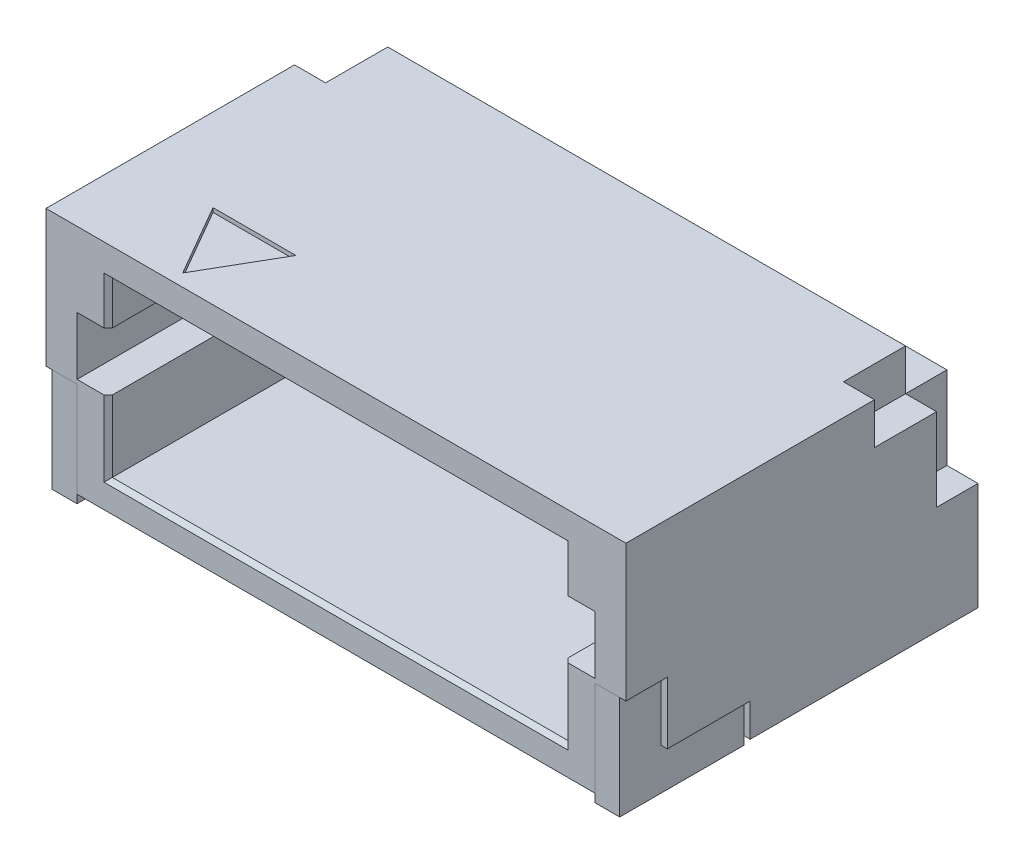
from build123d import *
from OCP.BRepFilletAPI import BRepFilletAPI_MakeChamfer

# Parameters (mm, degrees)
SKETCH1_W           = 4.25
SKETCH1_H           = 2.9
EXTRUDE1_DEPTH      = 3.5
EXTRUDE2_DEPTH      = 3.25
SKETCH3_W           = 0.2
SKETCH3_H           = 0.6
EXTRUDE3_DEPTH      = 2.25
LPATTERN1_COUNT     = 3
LPATTERN1_PITCH     = 1
LPATTERN1_COL_COUNT = 3
LPATTERN1_COL_PITCH = 1
CHAMFER1_SIZE       = 2
CHAMFER1_SIZE2      = 0.2
FILLET1_R           = 0.025
EXTRUDE4_DEPTH      = 0.375
EXTRUDE7_DEPTH      = 0.3
EXTRUDE8_DEPTH      = 0.3
EXTRUDE5_DEPTH      = 40.375
EXTRUDE5_DEPTH_BACK = 40.375
SKETCH6_W           = 0.5
SKETCH6_H           = 0.5
SKETCH7_W           = 0.2
SKETCH7_H           = 0.35
EXTRUDE6_DEPTH      = 40.375
LPATTERN2_COUNT     = 3
LPATTERN2_PITCH     = 1
LPATTERN2_COL_COUNT = 3
LPATTERN2_COL_PITCH = 1
CHAMFER2_SIZE       = 0.15
EXTRUDE10_DEPTH     = 0.1
EXTRUDE9_DEPTH      = 0.1
LPATTERN3_COUNT     = 3
LPATTERN3_PITCH     = 1
LPATTERN3_2_COUNT   = 3
LPATTERN3_2_PITCH   = 1
SKETCH12_W          = 0.2
SKETCH12_H          = 0.4
EXTRUDE11_DEPTH     = 0.05
LPATTERN4_COUNT     = 3
LPATTERN4_PITCH     = 1
LPATTERN4_COL_COUNT = 3
LPATTERN4_COL_PITCH = 1
CHAMFER3_SIZE       = 0.05
PIN_1_MARK_DEPTH    = 0.05


with BuildPart() as part:
    # Sketch1 → Extrude1 (new, symmetric)
    with BuildSketch(Plane(origin=(0, 0, 0), x_dir=(0, 0, -1), z_dir=(1, 0, 0))):
        with Locations((-2.125, 1.45)):
            Rectangle(SKETCH1_W, SKETCH1_H)
    extrude(amount=EXTRUDE1_DEPTH, both=True)

    # Sketch2 → Extrude2 (cut)
    with BuildSketch(Plane.XY.offset(4.25)):
        Polygon((2.75, 2), (3.125, 2), (3.125, 1.3), (2.75, 1.3), (2.75, 0.4375), (-2.75, 0.4375), (-2.75, 1.3), (-3.125, 1.3), (-3.125, 2), (-2.75, 2), (-2.75, 2.525), (2.75, 2.525), align=None)
    extrude(amount=-EXTRUDE2_DEPTH, mode=Mode.SUBTRACT)

    # Sketch3 → Extrude3 (add)
    with BuildSketch(Plane.XY.offset(1)):
        with Locations((0, 1.9)):
            Rectangle(SKETCH3_W, SKETCH3_H)
    extrude3 = extrude(amount=EXTRUDE3_DEPTH)

    # LPattern1: Extrude3 ×3
    with Locations(*[(-i * LPATTERN1_PITCH, 0, 0) for i in range(1, LPATTERN1_COUNT)]):
        add(extrude3)

    # LPattern1 col: Extrude3 ×3
    with Locations(*[(i * LPATTERN1_COL_PITCH, 0, 0) for i in range(1, LPATTERN1_COL_COUNT)]):
        add(extrude3)

    # Chamfer1: one chamfer whose edges measure the first distance from different faces: ONE call of the kernel's chamfer builder (chamfer() names one face for all edges)
    chamfer1_edges_1 = [part.edges().sort_by_distance(p)[0] for p in [
        (-2, 1.6, 3.25),
    ]]
    chamfer1_side_1 = [part.faces().sort_by_distance(p)[0] for p in [
        (-2, 1.6, 2.125),
    ]]
    chamfer1_edges_2 = [part.edges().sort_by_distance(p)[0] for p in [
        (-2, 2.2, 3.25),
    ]]
    chamfer1_side_2 = [part.faces().sort_by_distance(p)[0] for p in [
        (-2, 2.2, 2.125),
    ]]
    chamfer1_edges_3 = [part.edges().sort_by_distance(p)[0] for p in [
        (0, 1.6, 3.25),
    ]]
    chamfer1_side_3 = [part.faces().sort_by_distance(p)[0] for p in [
        (0, 1.6, 2.125),
    ]]
    chamfer1_edges_4 = [part.edges().sort_by_distance(p)[0] for p in [
        (0, 2.2, 3.25),
    ]]
    chamfer1_side_4 = [part.faces().sort_by_distance(p)[0] for p in [
        (0, 2.2, 2.125),
    ]]
    chamfer1_edges_5 = [part.edges().sort_by_distance(p)[0] for p in [
        (1, 1.6, 3.25),
    ]]
    chamfer1_side_5 = [part.faces().sort_by_distance(p)[0] for p in [
        (1, 1.6, 2.125),
    ]]
    chamfer1_edges_6 = [part.edges().sort_by_distance(p)[0] for p in [
        (1, 2.2, 3.25),
    ]]
    chamfer1_side_6 = [part.faces().sort_by_distance(p)[0] for p in [
        (1, 2.2, 2.125),
    ]]
    chamfer1_edges_7 = [part.edges().sort_by_distance(p)[0] for p in [
        (2, 1.6, 3.25),
    ]]
    chamfer1_side_7 = [part.faces().sort_by_distance(p)[0] for p in [
        (2, 1.6, 2.125),
    ]]
    chamfer1_edges_8 = [part.edges().sort_by_distance(p)[0] for p in [
        (2, 2.2, 3.25),
    ]]
    chamfer1_side_8 = [part.faces().sort_by_distance(p)[0] for p in [
        (2, 2.2, 2.125),
    ]]
    chamfer1_edges_9 = [part.edges().sort_by_distance(p)[0] for p in [
        (-1, 1.6, 3.25),
    ]]
    chamfer1_side_9 = [part.faces().sort_by_distance(p)[0] for p in [
        (-1, 1.6, 2.125),
    ]]
    chamfer1_edges_10 = [part.edges().sort_by_distance(p)[0] for p in [
        (-1, 2.2, 3.25),
    ]]
    chamfer1_side_10 = [part.faces().sort_by_distance(p)[0] for p in [
        (-1, 2.2, 2.125),
    ]]
    chamfer1 = BRepFilletAPI_MakeChamfer(part.part.solid().wrapped)
    for e in chamfer1_edges_1:
        chamfer1.Add(CHAMFER1_SIZE, CHAMFER1_SIZE2, e.wrapped, chamfer1_side_1[0].wrapped)  # the first distance lies on this face
    for e in chamfer1_edges_2:
        chamfer1.Add(CHAMFER1_SIZE, CHAMFER1_SIZE2, e.wrapped, chamfer1_side_2[0].wrapped)  # the first distance lies on this face
    for e in chamfer1_edges_3:
        chamfer1.Add(CHAMFER1_SIZE, CHAMFER1_SIZE2, e.wrapped, chamfer1_side_3[0].wrapped)  # the first distance lies on this face
    for e in chamfer1_edges_4:
        chamfer1.Add(CHAMFER1_SIZE, CHAMFER1_SIZE2, e.wrapped, chamfer1_side_4[0].wrapped)  # the first distance lies on this face
    for e in chamfer1_edges_5:
        chamfer1.Add(CHAMFER1_SIZE, CHAMFER1_SIZE2, e.wrapped, chamfer1_side_5[0].wrapped)  # the first distance lies on this face
    for e in chamfer1_edges_6:
        chamfer1.Add(CHAMFER1_SIZE, CHAMFER1_SIZE2, e.wrapped, chamfer1_side_6[0].wrapped)  # the first distance lies on this face
    for e in chamfer1_edges_7:
        chamfer1.Add(CHAMFER1_SIZE, CHAMFER1_SIZE2, e.wrapped, chamfer1_side_7[0].wrapped)  # the first distance lies on this face
    for e in chamfer1_edges_8:
        chamfer1.Add(CHAMFER1_SIZE, CHAMFER1_SIZE2, e.wrapped, chamfer1_side_8[0].wrapped)  # the first distance lies on this face
    for e in chamfer1_edges_9:
        chamfer1.Add(CHAMFER1_SIZE, CHAMFER1_SIZE2, e.wrapped, chamfer1_side_9[0].wrapped)  # the first distance lies on this face
    for e in chamfer1_edges_10:
        chamfer1.Add(CHAMFER1_SIZE, CHAMFER1_SIZE2, e.wrapped, chamfer1_side_10[0].wrapped)  # the first distance lies on this face
    add(Compound.cast(chamfer1.Shape()), mode=Mode.REPLACE)

    # Fillet1
    # the kernel refuses this fillet: 0.025 mm, written as the material it takes off along each edge
    with BuildSketch(Plane(origin=(2.075, 1.822624689, 3.225), x_dir=(0, -0.9950371902099892, 0.09950371902099889), z_dir=(1, 0, 0))) as fillet1_piece_1_section:
        Polygon((0, 0), (FILLET1_R, 0), (FILLET1_R, -FILLET1_R * 0.904987562112), (FILLET1_R * 0.099503719021, -FILLET1_R * 0.99503719021), align=None)
    fillet1_piece_1 = extrude(amount=FILLET1_R, mode=Mode.PRIVATE)
    fillet1_piece_1 = fillet1_piece_1 - Plane(origin=(2.075, 1.822624689, 3.225), x_dir=(0, 0.6710053207609464, -0.7414525335518785), z_dir=(1, 0, 0)) * Sphere(FILLET1_R, mode=Mode.PRIVATE)
    add(fillet1_piece_1, mode=Mode.SUBTRACT)
    with BuildSketch(Plane(origin=(1.925, 1.822624689, 3.225), x_dir=(0, -0.9950371902099892, 0.09950371902099889), z_dir=(-1, 0, 0))) as fillet1_piece_2_section:
        Polygon((0, 0), (FILLET1_R, 0), (FILLET1_R, FILLET1_R * 0.904987562112), (FILLET1_R * 0.099503719021, FILLET1_R * 0.99503719021), align=None)
    fillet1_piece_2 = extrude(amount=FILLET1_R, mode=Mode.PRIVATE)
    fillet1_piece_2 = fillet1_piece_2 - Plane(origin=(1.925, 1.822624689, 3.225), x_dir=(0, 0.6710053207609464, -0.7414525335518785), z_dir=(-1, 0, 0)) * Sphere(FILLET1_R, mode=Mode.PRIVATE)
    add(fillet1_piece_2, mode=Mode.SUBTRACT)
    with BuildSketch(Plane(origin=(1.925, 1.977375311, 3.225), x_dir=(0, 0.9950371902099892, 0.09950371902099889), z_dir=(-1, 0, 0))) as fillet1_piece_3_section:
        Polygon((0, 0), (FILLET1_R, 0), (FILLET1_R, -FILLET1_R * 0.904987562112), (FILLET1_R * 0.099503719021, -FILLET1_R * 0.99503719021), align=None)
    fillet1_piece_3 = extrude(amount=FILLET1_R, mode=Mode.PRIVATE)
    fillet1_piece_3 = fillet1_piece_3 - Plane(origin=(1.925, 1.977375311, 3.225), x_dir=(0, -0.6710053207609464, -0.7414525335518785), z_dir=(-1, 0, 0)) * Sphere(FILLET1_R, mode=Mode.PRIVATE)
    add(fillet1_piece_3, mode=Mode.SUBTRACT)
    with BuildSketch(Plane(origin=(2.075, 1.977375311, 3.225), x_dir=(0, 0, 1), z_dir=(1, 0, 0))) as fillet1_piece_4_section:
        Polygon((0, 0), (FILLET1_R, 0), (FILLET1_R, -FILLET1_R * 0.904987562112), (FILLET1_R * 0.099503719021, -FILLET1_R * 0.99503719021), align=None)
    fillet1_piece_4 = extrude(amount=FILLET1_R, mode=Mode.PRIVATE)
    fillet1_piece_4 = fillet1_piece_4 - Plane(origin=(2.075, 1.977375311, 3.225), x_dir=(0, -0.6710053207609464, -0.7414525335518785), z_dir=(1, 0, 0)) * Sphere(FILLET1_R, mode=Mode.PRIVATE)
    add(fillet1_piece_4, mode=Mode.SUBTRACT)
    with BuildSketch(Plane(origin=(1.075, 1.822624689, 3.225), x_dir=(0, -0.9950371902099892, 0.09950371902099889), z_dir=(1, 0, 0))) as fillet1_piece_5_section:
        Polygon((0, 0), (FILLET1_R, 0), (FILLET1_R, -FILLET1_R * 0.904987562112), (FILLET1_R * 0.099503719021, -FILLET1_R * 0.99503719021), align=None)
    fillet1_piece_5 = extrude(amount=FILLET1_R, mode=Mode.PRIVATE)
    fillet1_piece_5 = fillet1_piece_5 - Plane(origin=(1.075, 1.822624689, 3.225), x_dir=(0, 0.6710053207609464, -0.7414525335518785), z_dir=(1, 0, 0)) * Sphere(FILLET1_R, mode=Mode.PRIVATE)
    add(fillet1_piece_5, mode=Mode.SUBTRACT)
    with BuildSketch(Plane(origin=(0.925, 1.822624689, 3.225), x_dir=(0, -0.9950371902099892, 0.09950371902099889), z_dir=(-1, 0, 0))) as fillet1_piece_6_section:
        Polygon((0, 0), (FILLET1_R, 0), (FILLET1_R, FILLET1_R * 0.904987562112), (FILLET1_R * 0.099503719021, FILLET1_R * 0.99503719021), align=None)
    fillet1_piece_6 = extrude(amount=FILLET1_R, mode=Mode.PRIVATE)
    fillet1_piece_6 = fillet1_piece_6 - Plane(origin=(0.925, 1.822624689, 3.225), x_dir=(0, 0.6710053207609464, -0.7414525335518785), z_dir=(-1, 0, 0)) * Sphere(FILLET1_R, mode=Mode.PRIVATE)
    add(fillet1_piece_6, mode=Mode.SUBTRACT)
    with BuildSketch(Plane(origin=(0.925, 1.977375311, 3.225), x_dir=(0, 0, 1), z_dir=(-1, 0, 0))) as fillet1_piece_7_section:
        Polygon((0, 0), (FILLET1_R, 0), (FILLET1_R, FILLET1_R * 0.904987562112), (FILLET1_R * 0.099503719021, FILLET1_R * 0.99503719021), align=None)
    fillet1_piece_7 = extrude(amount=FILLET1_R, mode=Mode.PRIVATE)
    fillet1_piece_7 = fillet1_piece_7 - Plane(origin=(0.925, 1.977375311, 3.225), x_dir=(0, -0.6710053207609464, -0.7414525335518785), z_dir=(-1, 0, 0)) * Sphere(FILLET1_R, mode=Mode.PRIVATE)
    add(fillet1_piece_7, mode=Mode.SUBTRACT)
    with BuildSketch(Plane(origin=(1.075, 1.977375311, 3.225), x_dir=(0, 0, 1), z_dir=(1, 0, 0))) as fillet1_piece_8_section:
        Polygon((0, 0), (FILLET1_R, 0), (FILLET1_R, -FILLET1_R * 0.904987562112), (FILLET1_R * 0.099503719021, -FILLET1_R * 0.99503719021), align=None)
    fillet1_piece_8 = extrude(amount=FILLET1_R, mode=Mode.PRIVATE)
    fillet1_piece_8 = fillet1_piece_8 - Plane(origin=(1.075, 1.977375311, 3.225), x_dir=(0, -0.6710053207609464, -0.7414525335518785), z_dir=(1, 0, 0)) * Sphere(FILLET1_R, mode=Mode.PRIVATE)
    add(fillet1_piece_8, mode=Mode.SUBTRACT)
    with BuildSketch(Plane(origin=(-0.075, 1.977375311, 3.225), x_dir=(0, 0, 1), z_dir=(-1, 0, 0))) as fillet1_piece_9_section:
        Polygon((0, 0), (FILLET1_R, 0), (FILLET1_R, FILLET1_R * 0.904987562112), (FILLET1_R * 0.099503719021, FILLET1_R * 0.99503719021), align=None)
    fillet1_piece_9 = extrude(amount=FILLET1_R, mode=Mode.PRIVATE)
    fillet1_piece_9 = fillet1_piece_9 - Plane(origin=(-0.075, 1.977375311, 3.225), x_dir=(0, -0.6710053207609464, -0.7414525335518785), z_dir=(-1, 0, 0)) * Sphere(FILLET1_R, mode=Mode.PRIVATE)
    add(fillet1_piece_9, mode=Mode.SUBTRACT)
    with BuildSketch(Plane(origin=(0.075, 1.977375311, 3.225), x_dir=(0, 0.9950371902099892, 0.09950371902099889), z_dir=(1, 0, 0))) as fillet1_piece_10_section:
        Polygon((0, 0), (FILLET1_R, 0), (FILLET1_R, FILLET1_R * 0.904987562112), (FILLET1_R * 0.099503719021, FILLET1_R * 0.99503719021), align=None)
    fillet1_piece_10 = extrude(amount=FILLET1_R, mode=Mode.PRIVATE)
    fillet1_piece_10 = fillet1_piece_10 - Plane(origin=(0.075, 1.977375311, 3.225), x_dir=(0, -0.6710053207609464, -0.7414525335518785), z_dir=(1, 0, 0)) * Sphere(FILLET1_R, mode=Mode.PRIVATE)
    add(fillet1_piece_10, mode=Mode.SUBTRACT)
    with BuildSketch(Plane(origin=(0.075, 1.822624689, 3.225), x_dir=(0, 0, 1), z_dir=(1, 0, 0))) as fillet1_piece_11_section:
        Polygon((0, 0), (FILLET1_R, 0), (FILLET1_R, FILLET1_R * 0.904987562112), (FILLET1_R * 0.099503719021, FILLET1_R * 0.99503719021), align=None)
    fillet1_piece_11 = extrude(amount=FILLET1_R, mode=Mode.PRIVATE)
    fillet1_piece_11 = fillet1_piece_11 - Plane(origin=(0.075, 1.822624689, 3.225), x_dir=(0, 0.6710053207609464, -0.7414525335518785), z_dir=(1, 0, 0)) * Sphere(FILLET1_R, mode=Mode.PRIVATE)
    add(fillet1_piece_11, mode=Mode.SUBTRACT)
    with BuildSketch(Plane(origin=(-0.075, 1.822624689, 3.225), x_dir=(0, -0.9950371902099892, 0.09950371902099889), z_dir=(-1, 0, 0))) as fillet1_piece_12_section:
        Polygon((0, 0), (FILLET1_R, 0), (FILLET1_R, FILLET1_R * 0.904987562112), (FILLET1_R * 0.099503719021, FILLET1_R * 0.99503719021), align=None)
    fillet1_piece_12 = extrude(amount=FILLET1_R, mode=Mode.PRIVATE)
    fillet1_piece_12 = fillet1_piece_12 - Plane(origin=(-0.075, 1.822624689, 3.225), x_dir=(0, 0.6710053207609464, -0.7414525335518785), z_dir=(-1, 0, 0)) * Sphere(FILLET1_R, mode=Mode.PRIVATE)
    add(fillet1_piece_12, mode=Mode.SUBTRACT)
    with BuildSketch(Plane(origin=(-0.925, 1.822624689, 3.225), x_dir=(0, -0.9950371902099892, 0.09950371902099889), z_dir=(1, 0, 0))) as fillet1_piece_13_section:
        Polygon((0, 0), (FILLET1_R, 0), (FILLET1_R, -FILLET1_R * 0.904987562112), (FILLET1_R * 0.099503719021, -FILLET1_R * 0.99503719021), align=None)
    fillet1_piece_13 = extrude(amount=FILLET1_R, mode=Mode.PRIVATE)
    fillet1_piece_13 = fillet1_piece_13 - Plane(origin=(-0.925, 1.822624689, 3.225), x_dir=(0, 0.6710053207609464, -0.7414525335518785), z_dir=(1, 0, 0)) * Sphere(FILLET1_R, mode=Mode.PRIVATE)
    add(fillet1_piece_13, mode=Mode.SUBTRACT)
    with BuildSketch(Plane(origin=(-1.075, 1.822624689, 3.225), x_dir=(0, -0.9950371902099892, 0.09950371902099889), z_dir=(-1, 0, 0))) as fillet1_piece_14_section:
        Polygon((0, 0), (FILLET1_R, 0), (FILLET1_R, FILLET1_R * 0.904987562112), (FILLET1_R * 0.099503719021, FILLET1_R * 0.99503719021), align=None)
    fillet1_piece_14 = extrude(amount=FILLET1_R, mode=Mode.PRIVATE)
    fillet1_piece_14 = fillet1_piece_14 - Plane(origin=(-1.075, 1.822624689, 3.225), x_dir=(0, 0.6710053207609464, -0.7414525335518785), z_dir=(-1, 0, 0)) * Sphere(FILLET1_R, mode=Mode.PRIVATE)
    add(fillet1_piece_14, mode=Mode.SUBTRACT)
    with BuildSketch(Plane(origin=(-1.075, 1.977375311, 3.225), x_dir=(0, 0.9950371902099892, 0.09950371902099889), z_dir=(-1, 0, 0))) as fillet1_piece_15_section:
        Polygon((0, 0), (FILLET1_R, 0), (FILLET1_R, -FILLET1_R * 0.904987562112), (FILLET1_R * 0.099503719021, -FILLET1_R * 0.99503719021), align=None)
    fillet1_piece_15 = extrude(amount=FILLET1_R, mode=Mode.PRIVATE)
    fillet1_piece_15 = fillet1_piece_15 - Plane(origin=(-1.075, 1.977375311, 3.225), x_dir=(0, -0.6710053207609464, -0.7414525335518785), z_dir=(-1, 0, 0)) * Sphere(FILLET1_R, mode=Mode.PRIVATE)
    add(fillet1_piece_15, mode=Mode.SUBTRACT)
    with BuildSketch(Plane(origin=(-0.925, 1.977375311, 3.225), x_dir=(0, 0.9950371902099892, 0.09950371902099889), z_dir=(1, 0, 0))) as fillet1_piece_16_section:
        Polygon((0, 0), (FILLET1_R, 0), (FILLET1_R, FILLET1_R * 0.904987562112), (FILLET1_R * 0.099503719021, FILLET1_R * 0.99503719021), align=None)
    fillet1_piece_16 = extrude(amount=FILLET1_R, mode=Mode.PRIVATE)
    fillet1_piece_16 = fillet1_piece_16 - Plane(origin=(-0.925, 1.977375311, 3.225), x_dir=(0, -0.6710053207609464, -0.7414525335518785), z_dir=(1, 0, 0)) * Sphere(FILLET1_R, mode=Mode.PRIVATE)
    add(fillet1_piece_16, mode=Mode.SUBTRACT)
    with BuildSketch(Plane(origin=(-1.925, 1.822624689, 3.225), x_dir=(0, -0.9950371902099892, 0.09950371902099889), z_dir=(1, 0, 0))) as fillet1_piece_17_section:
        Polygon((0, 0), (FILLET1_R, 0), (FILLET1_R, -FILLET1_R * 0.904987562112), (FILLET1_R * 0.099503719021, -FILLET1_R * 0.99503719021), align=None)
    fillet1_piece_17 = extrude(amount=FILLET1_R, mode=Mode.PRIVATE)
    fillet1_piece_17 = fillet1_piece_17 - Plane(origin=(-1.925, 1.822624689, 3.225), x_dir=(0, 0.6710053207609464, -0.7414525335518785), z_dir=(1, 0, 0)) * Sphere(FILLET1_R, mode=Mode.PRIVATE)
    add(fillet1_piece_17, mode=Mode.SUBTRACT)
    with BuildSketch(Plane(origin=(-2.075, 1.822624689, 3.225), x_dir=(0, -0.9950371902099892, 0.09950371902099889), z_dir=(-1, 0, 0))) as fillet1_piece_18_section:
        Polygon((0, 0), (FILLET1_R, 0), (FILLET1_R, FILLET1_R * 0.904987562112), (FILLET1_R * 0.099503719021, FILLET1_R * 0.99503719021), align=None)
    fillet1_piece_18 = extrude(amount=FILLET1_R, mode=Mode.PRIVATE)
    fillet1_piece_18 = fillet1_piece_18 - Plane(origin=(-2.075, 1.822624689, 3.225), x_dir=(0, 0.6710053207609464, -0.7414525335518785), z_dir=(-1, 0, 0)) * Sphere(FILLET1_R, mode=Mode.PRIVATE)
    add(fillet1_piece_18, mode=Mode.SUBTRACT)
    with BuildSketch(Plane(origin=(-2.075, 1.977375311, 3.225), x_dir=(0, 0.9950371902099892, 0.09950371902099889), z_dir=(-1, 0, 0))) as fillet1_piece_19_section:
        Polygon((0, 0), (FILLET1_R, 0), (FILLET1_R, -FILLET1_R * 0.904987562112), (FILLET1_R * 0.099503719021, -FILLET1_R * 0.99503719021), align=None)
    fillet1_piece_19 = extrude(amount=FILLET1_R, mode=Mode.PRIVATE)
    fillet1_piece_19 = fillet1_piece_19 - Plane(origin=(-2.075, 1.977375311, 3.225), x_dir=(0, -0.6710053207609464, -0.7414525335518785), z_dir=(-1, 0, 0)) * Sphere(FILLET1_R, mode=Mode.PRIVATE)
    add(fillet1_piece_19, mode=Mode.SUBTRACT)
    with BuildSketch(Plane(origin=(-1.925, 1.977375311, 3.225), x_dir=(0, 0.9950371902099892, 0.09950371902099889), z_dir=(1, 0, 0))) as fillet1_piece_20_section:
        Polygon((0, 0), (FILLET1_R, 0), (FILLET1_R, FILLET1_R * 0.904987562112), (FILLET1_R * 0.099503719021, FILLET1_R * 0.99503719021), align=None)
    fillet1_piece_20 = extrude(amount=FILLET1_R, mode=Mode.PRIVATE)
    fillet1_piece_20 = fillet1_piece_20 - Plane(origin=(-1.925, 1.977375311, 3.225), x_dir=(0, -0.6710053207609464, -0.7414525335518785), z_dir=(1, 0, 0)) * Sphere(FILLET1_R, mode=Mode.PRIVATE)
    add(fillet1_piece_20, mode=Mode.SUBTRACT)
    with BuildSketch(Plane(origin=(2.075, 1.8, 3.25), x_dir=(0, -0.09950371902100087, -0.995037190209989), z_dir=(-1, 0, 0)), Plane(origin=(1.925, 2, 3.25), x_dir=(0, 0.09950371902098919, -0.99503719020999), z_dir=(1, 0, 0)), Plane(origin=(1.075, 1.8, 3.25), x_dir=(0, -0.09950371902100087, -0.995037190209989), z_dir=(-1, 0, 0)), Plane(origin=(0.925, 2, 3.25), x_dir=(0, 0.09950371902098919, -0.99503719020999), z_dir=(1, 0, 0)), Plane(origin=(-0.075, 2, 3.25), x_dir=(0, 0.09950371902098919, -0.99503719020999), z_dir=(1, 0, 0)), Plane(origin=(0.075, 1.8, 3.25), x_dir=(0, -0.09950371902100087, -0.995037190209989), z_dir=(-1, 0, 0)), Plane(origin=(-0.925, 1.8, 3.25), x_dir=(0, -0.09950371902100087, -0.995037190209989), z_dir=(-1, 0, 0)), Plane(origin=(-1.075, 2, 3.25), x_dir=(0, 0.09950371902098919, -0.99503719020999), z_dir=(1, 0, 0)), Plane(origin=(-1.925, 1.8, 3.25), x_dir=(0, -0.09950371902100087, -0.995037190209989), z_dir=(-1, 0, 0)), Plane(origin=(-2.075, 2, 3.25), x_dir=(0, 0.09950371902098919, -0.99503719020999), z_dir=(1, 0, 0))) as fillet1_piece_21:
        with BuildLine():
            CenterArc((FILLET1_R * 0.904987562112, -FILLET1_R), FILLET1_R, 90, 84.289406863)
            Line((-FILLET1_R * 0.0900496280979, -FILLET1_R * 0.900496280979), (0, 0))
            Line((0, 0), (FILLET1_R * 0.904987562112, 0))
        make_face()
    extrude(amount=0.15, mode=Mode.SUBTRACT)
    with BuildSketch(Plane(origin=(1.9, 1.822624689, 3.25), x_dir=(0, 0, -1), z_dir=(0, 1, 0)), Plane(origin=(2.1, 1.977375311, 3.25), x_dir=(0, 0, -1), z_dir=(0, -1, 0)), Plane(origin=(0.9, 1.822624689, 3.25), x_dir=(0, 0, -1), z_dir=(0, 1, 0)), Plane(origin=(1.1, 1.977375311, 3.25), x_dir=(0, 0, -1), z_dir=(0, -1, 0)), Plane(origin=(0.1, 1.977375311, 3.25), x_dir=(0, 0, -1), z_dir=(0, -1, 0)), Plane(origin=(-0.1, 1.822624689, 3.25), x_dir=(0, 0, -1), z_dir=(0, 1, 0)), Plane(origin=(-1.1, 1.822624689, 3.25), x_dir=(0, 0, -1), z_dir=(0, 1, 0)), Plane(origin=(-0.9, 1.977375311, 3.25), x_dir=(0, 0, -1), z_dir=(0, -1, 0)), Plane(origin=(-2.1, 1.822624689, 3.25), x_dir=(0, 0, -1), z_dir=(0, 1, 0)), Plane(origin=(-1.9, 1.977375311, 3.25), x_dir=(0, 0, -1), z_dir=(0, -1, 0))) as fillet1_piece_22:
        with BuildLine():
            CenterArc((FILLET1_R, -FILLET1_R), FILLET1_R, 90, 90)
            Line((0, -FILLET1_R), (0, 0))
            Line((0, 0), (FILLET1_R, 0))
        make_face()
    extrude(amount=0.154750622, mode=Mode.SUBTRACT)
    with BuildSketch(Plane(origin=(-2.1, 2.231094912, 0.939050878), x_dir=(0, -0.9950371902099892, -0.09950371902099889), z_dir=(0, -0.09950371902099889, 0.9950371902099892))) as fillet1_piece_23_section:
        with BuildLine():
            CenterArc((FILLET1_R, FILLET1_R), FILLET1_R, 180, 90)
            Line((0, FILLET1_R), (0, 0))
            Line((0, 0), (FILLET1_R, 0))
        make_face()
    fillet1_piece_23 = extrude(amount=2.299850435, mode=Mode.PRIVATE)
    fillet1_piece_23 = split(fillet1_piece_23, bisect_by=Plane(origin=(-2.1, 2.231094912, 1), z_dir=(0, 0, 1)), keep=Keep.TOP, mode=Mode.PRIVATE)
    add(fillet1_piece_23, mode=Mode.SUBTRACT)
    with BuildSketch(Plane(origin=(-1.9, 2.231094912, 0.939050878), x_dir=(0, -0.9950371902099892, -0.09950371902099889), z_dir=(0, -0.09950371902099889, 0.9950371902099892))) as fillet1_piece_24_section:
        with BuildLine():
            CenterArc((FILLET1_R, -FILLET1_R), FILLET1_R, 90, 90)
            Line((0, -FILLET1_R), (0, 0))
            Line((0, 0), (FILLET1_R, 0))
        make_face()
    fillet1_piece_24 = extrude(amount=2.299850435, mode=Mode.PRIVATE)
    fillet1_piece_24 = split(fillet1_piece_24, bisect_by=Plane(origin=(-1.9, 2.231094912, 1), z_dir=(0, 0, 1)), keep=Keep.TOP, mode=Mode.PRIVATE)
    add(fillet1_piece_24, mode=Mode.SUBTRACT)
    with BuildSketch(Plane(origin=(-2.1, 1.568905088, 0.939050878), x_dir=(0, 0.995037190209989, -0.09950371902099889), z_dir=(0, 0.09950371902099889, 0.9950371902099892))) as fillet1_piece_25_section:
        with BuildLine():
            CenterArc((FILLET1_R, -FILLET1_R), FILLET1_R, 90, 90)
            Line((0, -FILLET1_R), (0, 0))
            Line((0, 0), (FILLET1_R, 0))
        make_face()
    fillet1_piece_25 = extrude(amount=2.299850435, mode=Mode.PRIVATE)
    fillet1_piece_25 = split(fillet1_piece_25, bisect_by=Plane(origin=(-2.1, 1.568905088, 1), z_dir=(0, 0, 1)), keep=Keep.TOP, mode=Mode.PRIVATE)
    add(fillet1_piece_25, mode=Mode.SUBTRACT)
    with BuildSketch(Plane(origin=(-1.9, 1.568905088, 0.939050878), x_dir=(0, 0.9950371902099892, -0.09950371902099889), z_dir=(0, 0.09950371902099889, 0.9950371902099892))) as fillet1_piece_26_section:
        with BuildLine():
            CenterArc((FILLET1_R, FILLET1_R), FILLET1_R, 180, 90)
            Line((0, FILLET1_R), (0, 0))
            Line((0, 0), (FILLET1_R, 0))
        make_face()
    fillet1_piece_26 = extrude(amount=2.299850435, mode=Mode.PRIVATE)
    fillet1_piece_26 = split(fillet1_piece_26, bisect_by=Plane(origin=(-1.9, 1.568905088, 1), z_dir=(0, 0, 1)), keep=Keep.TOP, mode=Mode.PRIVATE)
    add(fillet1_piece_26, mode=Mode.SUBTRACT)
    with BuildSketch(Plane(origin=(-0.1, 1.568905088, 0.939050878), x_dir=(0, 0.995037190209989, -0.09950371902099889), z_dir=(0, 0.09950371902099889, 0.9950371902099892))) as fillet1_piece_27_section:
        with BuildLine():
            CenterArc((FILLET1_R, -FILLET1_R), FILLET1_R, 90, 90)
            Line((0, -FILLET1_R), (0, 0))
            Line((0, 0), (FILLET1_R, 0))
        make_face()
    fillet1_piece_27 = extrude(amount=2.299850435, mode=Mode.PRIVATE)
    fillet1_piece_27 = split(fillet1_piece_27, bisect_by=Plane(origin=(-0.1, 1.568905088, 1), z_dir=(0, 0, 1)), keep=Keep.TOP, mode=Mode.PRIVATE)
    add(fillet1_piece_27, mode=Mode.SUBTRACT)
    with BuildSketch(Plane(origin=(0.1, 2.231094912, 0.939050878), x_dir=(0, -0.9950371902099892, -0.09950371902099889), z_dir=(0, -0.09950371902099889, 0.9950371902099892))) as fillet1_piece_28_section:
        with BuildLine():
            CenterArc((FILLET1_R, -FILLET1_R), FILLET1_R, 90, 90)
            Line((0, -FILLET1_R), (0, 0))
            Line((0, 0), (FILLET1_R, 0))
        make_face()
    fillet1_piece_28 = extrude(amount=2.299850435, mode=Mode.PRIVATE)
    fillet1_piece_28 = split(fillet1_piece_28, bisect_by=Plane(origin=(0.1, 2.231094912, 1), z_dir=(0, 0, 1)), keep=Keep.TOP, mode=Mode.PRIVATE)
    add(fillet1_piece_28, mode=Mode.SUBTRACT)
    with BuildSketch(Plane(origin=(-0.1, 2.231094912, 0.939050878), x_dir=(0, -0.9950371902099892, -0.09950371902099889), z_dir=(0, -0.09950371902099889, 0.9950371902099892))) as fillet1_piece_29_section:
        with BuildLine():
            CenterArc((FILLET1_R, FILLET1_R), FILLET1_R, 180, 90)
            Line((0, FILLET1_R), (0, 0))
            Line((0, 0), (FILLET1_R, 0))
        make_face()
    fillet1_piece_29 = extrude(amount=2.299850435, mode=Mode.PRIVATE)
    fillet1_piece_29 = split(fillet1_piece_29, bisect_by=Plane(origin=(-0.1, 2.231094912, 1), z_dir=(0, 0, 1)), keep=Keep.TOP, mode=Mode.PRIVATE)
    add(fillet1_piece_29, mode=Mode.SUBTRACT)
    with BuildSketch(Plane(origin=(0.1, 1.568905088, 0.939050878), x_dir=(0, 0.995037190209989, -0.09950371902099889), z_dir=(0, 0.09950371902099889, 0.9950371902099892))) as fillet1_piece_30_section:
        with BuildLine():
            CenterArc((FILLET1_R, FILLET1_R), FILLET1_R, 180, 90)
            Line((0, FILLET1_R), (0, 0))
            Line((0, 0), (FILLET1_R, 0))
        make_face()
    fillet1_piece_30 = extrude(amount=2.299850435, mode=Mode.PRIVATE)
    fillet1_piece_30 = split(fillet1_piece_30, bisect_by=Plane(origin=(0.1, 1.568905088, 1), z_dir=(0, 0, 1)), keep=Keep.TOP, mode=Mode.PRIVATE)
    add(fillet1_piece_30, mode=Mode.SUBTRACT)
    with BuildSketch(Plane(origin=(2.1, 2.231094912, 0.939050878), x_dir=(-1, 0, 0), z_dir=(0, -0.09950371902099889, 0.9950371902099892))) as fillet1_piece_31_section:
        with BuildLine():
            CenterArc((FILLET1_R, FILLET1_R), FILLET1_R, 180, 90)
            Line((0, FILLET1_R), (0, 0))
            Line((0, 0), (FILLET1_R, 0))
        make_face()
    fillet1_piece_31 = extrude(amount=2.299850435, mode=Mode.PRIVATE)
    fillet1_piece_31 = split(fillet1_piece_31, bisect_by=Plane(origin=(2.1, 2.231094912, 1), z_dir=(0, 0, 1)), keep=Keep.TOP, mode=Mode.PRIVATE)
    add(fillet1_piece_31, mode=Mode.SUBTRACT)
    with BuildSketch(Plane(origin=(1.9, 2.231094912, 0.939050878), x_dir=(0, -0.9950371902099892, -0.09950371902099889), z_dir=(0, -0.09950371902099889, 0.9950371902099892))) as fillet1_piece_32_section:
        with BuildLine():
            CenterArc((FILLET1_R, FILLET1_R), FILLET1_R, 180, 90)
            Line((0, FILLET1_R), (0, 0))
            Line((0, 0), (FILLET1_R, 0))
        make_face()
    fillet1_piece_32 = extrude(amount=2.299850435, mode=Mode.PRIVATE)
    fillet1_piece_32 = split(fillet1_piece_32, bisect_by=Plane(origin=(1.9, 2.231094912, 1), z_dir=(0, 0, 1)), keep=Keep.TOP, mode=Mode.PRIVATE)
    add(fillet1_piece_32, mode=Mode.SUBTRACT)
    with BuildSketch(Plane(origin=(2.1, 1.568905088, 0.939050878), x_dir=(-1.776356839400255e-14, 0.995037190209989, -0.09950371902099889), z_dir=(0, 0.09950371902099889, 0.9950371902099892))) as fillet1_piece_33_section:
        with BuildLine():
            CenterArc((FILLET1_R, FILLET1_R), FILLET1_R, 180, 90)
            Line((0, FILLET1_R), (0, 0))
            Line((0, 0), (FILLET1_R, 0))
        make_face()
    fillet1_piece_33 = extrude(amount=2.299850435, mode=Mode.PRIVATE)
    fillet1_piece_33 = split(fillet1_piece_33, bisect_by=Plane(origin=(2.1, 1.568905088, 1), z_dir=(0, 0, 1)), keep=Keep.TOP, mode=Mode.PRIVATE)
    add(fillet1_piece_33, mode=Mode.SUBTRACT)
    with BuildSketch(Plane(origin=(1.9, 1.568905088, 0.939050878), x_dir=(0, 0.995037190209989, -0.09950371902099889), z_dir=(0, 0.09950371902099889, 0.9950371902099892))) as fillet1_piece_34_section:
        with BuildLine():
            CenterArc((FILLET1_R, -FILLET1_R), FILLET1_R, 90, 90)
            Line((0, -FILLET1_R), (0, 0))
            Line((0, 0), (FILLET1_R, 0))
        make_face()
    fillet1_piece_34 = extrude(amount=2.299850435, mode=Mode.PRIVATE)
    fillet1_piece_34 = split(fillet1_piece_34, bisect_by=Plane(origin=(1.9, 1.568905088, 1), z_dir=(0, 0, 1)), keep=Keep.TOP, mode=Mode.PRIVATE)
    add(fillet1_piece_34, mode=Mode.SUBTRACT)
    with BuildSketch(Plane(origin=(0.9, 1.568905088, 0.939050878), x_dir=(0, 0.995037190209989, -0.09950371902099889), z_dir=(0, 0.09950371902099889, 0.9950371902099892))) as fillet1_piece_35_section:
        with BuildLine():
            CenterArc((FILLET1_R, -FILLET1_R), FILLET1_R, 90, 90)
            Line((0, -FILLET1_R), (0, 0))
            Line((0, 0), (FILLET1_R, 0))
        make_face()
    fillet1_piece_35 = extrude(amount=2.299850435, mode=Mode.PRIVATE)
    fillet1_piece_35 = split(fillet1_piece_35, bisect_by=Plane(origin=(0.9, 1.568905088, 1), z_dir=(0, 0, 1)), keep=Keep.TOP, mode=Mode.PRIVATE)
    add(fillet1_piece_35, mode=Mode.SUBTRACT)
    with BuildSketch(Plane(origin=(1.1, 1.568905088, 0.939050878), x_dir=(0, 0.995037190209989, -0.09950371902099889), z_dir=(0, 0.09950371902099889, 0.9950371902099892))) as fillet1_piece_36_section:
        with BuildLine():
            CenterArc((FILLET1_R, FILLET1_R), FILLET1_R, 180, 90)
            Line((0, FILLET1_R), (0, 0))
            Line((0, 0), (FILLET1_R, 0))
        make_face()
    fillet1_piece_36 = extrude(amount=2.299850435, mode=Mode.PRIVATE)
    fillet1_piece_36 = split(fillet1_piece_36, bisect_by=Plane(origin=(1.1, 1.568905088, 1), z_dir=(0, 0, 1)), keep=Keep.TOP, mode=Mode.PRIVATE)
    add(fillet1_piece_36, mode=Mode.SUBTRACT)
    with BuildSketch(Plane(origin=(1.1, 2.231094912, 0.939050878), x_dir=(-8.881784197001197e-15, -0.9950371902099892, -0.09950371902099889), z_dir=(0, -0.09950371902099889, 0.9950371902099892))) as fillet1_piece_37_section:
        with BuildLine():
            CenterArc((FILLET1_R, -FILLET1_R), FILLET1_R, 90, 90)
            Line((0, -FILLET1_R), (0, 0))
            Line((0, 0), (FILLET1_R, 0))
        make_face()
    fillet1_piece_37 = extrude(amount=2.299850435, mode=Mode.PRIVATE)
    fillet1_piece_37 = split(fillet1_piece_37, bisect_by=Plane(origin=(1.1, 2.231094912, 1), z_dir=(0, 0, 1)), keep=Keep.TOP, mode=Mode.PRIVATE)
    add(fillet1_piece_37, mode=Mode.SUBTRACT)
    with BuildSketch(Plane(origin=(0.9, 2.231094912, 0.939050878), x_dir=(0, -0.9950371902099892, -0.09950371902099889), z_dir=(0, -0.09950371902099889, 0.9950371902099892))) as fillet1_piece_38_section:
        with BuildLine():
            CenterArc((FILLET1_R, FILLET1_R), FILLET1_R, 180, 90)
            Line((0, FILLET1_R), (0, 0))
            Line((0, 0), (FILLET1_R, 0))
        make_face()
    fillet1_piece_38 = extrude(amount=2.299850435, mode=Mode.PRIVATE)
    fillet1_piece_38 = split(fillet1_piece_38, bisect_by=Plane(origin=(0.9, 2.231094912, 1), z_dir=(0, 0, 1)), keep=Keep.TOP, mode=Mode.PRIVATE)
    add(fillet1_piece_38, mode=Mode.SUBTRACT)
    with BuildSketch(Plane(origin=(-0.9, 2.231094912, 0.939050878), x_dir=(4.4408920985005986e-15, -0.9950371902099892, -0.09950371902099889), z_dir=(0, -0.09950371902099889, 0.9950371902099892))) as fillet1_piece_39_section:
        with BuildLine():
            CenterArc((FILLET1_R, -FILLET1_R), FILLET1_R, 90, 90)
            Line((0, -FILLET1_R), (0, 0))
            Line((0, 0), (FILLET1_R, 0))
        make_face()
    fillet1_piece_39 = extrude(amount=2.299850435, mode=Mode.PRIVATE)
    fillet1_piece_39 = split(fillet1_piece_39, bisect_by=Plane(origin=(-0.9, 2.231094912, 1), z_dir=(0, 0, 1)), keep=Keep.TOP, mode=Mode.PRIVATE)
    add(fillet1_piece_39, mode=Mode.SUBTRACT)
    with BuildSketch(Plane(origin=(-1.1, 2.231094912, 0.939050878), x_dir=(0, -0.9950371902099892, -0.09950371902099889), z_dir=(0, -0.09950371902099889, 0.9950371902099892))) as fillet1_piece_40_section:
        with BuildLine():
            CenterArc((FILLET1_R, FILLET1_R), FILLET1_R, 180, 90)
            Line((0, FILLET1_R), (0, 0))
            Line((0, 0), (FILLET1_R, 0))
        make_face()
    fillet1_piece_40 = extrude(amount=2.299850435, mode=Mode.PRIVATE)
    fillet1_piece_40 = split(fillet1_piece_40, bisect_by=Plane(origin=(-1.1, 2.231094912, 1), z_dir=(0, 0, 1)), keep=Keep.TOP, mode=Mode.PRIVATE)
    add(fillet1_piece_40, mode=Mode.SUBTRACT)
    with BuildSketch(Plane(origin=(-1.1, 1.568905088, 0.939050878), x_dir=(0, 0.995037190209989, -0.09950371902099889), z_dir=(0, 0.09950371902099889, 0.9950371902099892))) as fillet1_piece_41_section:
        with BuildLine():
            CenterArc((FILLET1_R, -FILLET1_R), FILLET1_R, 90, 90)
            Line((0, -FILLET1_R), (0, 0))
            Line((0, 0), (FILLET1_R, 0))
        make_face()
    fillet1_piece_41 = extrude(amount=2.299850435, mode=Mode.PRIVATE)
    fillet1_piece_41 = split(fillet1_piece_41, bisect_by=Plane(origin=(-1.1, 1.568905088, 1), z_dir=(0, 0, 1)), keep=Keep.TOP, mode=Mode.PRIVATE)
    add(fillet1_piece_41, mode=Mode.SUBTRACT)
    with BuildSketch(Plane(origin=(-0.9, 1.568905088, 0.939050878), x_dir=(4.440892098500637e-15, 0.995037190209989, -0.09950371902099889), z_dir=(0, 0.09950371902099889, 0.9950371902099892))) as fillet1_piece_42_section:
        with BuildLine():
            CenterArc((FILLET1_R, FILLET1_R), FILLET1_R, 180, 90)
            Line((0, FILLET1_R), (0, 0))
            Line((0, 0), (FILLET1_R, 0))
        make_face()
    fillet1_piece_42 = extrude(amount=2.299850435, mode=Mode.PRIVATE)
    fillet1_piece_42 = split(fillet1_piece_42, bisect_by=Plane(origin=(-0.9, 1.568905088, 1), z_dir=(0, 0, 1)), keep=Keep.TOP, mode=Mode.PRIVATE)
    add(fillet1_piece_42, mode=Mode.SUBTRACT)

    # Sketch4 → Extrude4 (cut)
    with BuildSketch(Plane(origin=(3.5, 0, 0), x_dir=(0, 0, -1), z_dir=(1, 0, 0))):
        Polygon((-4.25, 1.25), (-3.75, 1.25), (-3.75, 0.5), (-2.75, 0.5), (-2.75, 0), (-4.25, 0), align=None)
        Polygon((-1.25, 2.9), (-1.25, 2.4), (-0.5, 2.4), (-0.5, 1.4), (0, 1.4), (0, 2.9), align=None)
    extrude4 = extrude(amount=-EXTRUDE4_DEPTH, mode=Mode.SUBTRACT)

    # Mirror1: Extrude4 across plane
    add(extrude4.mirror(Plane(origin=(0, 0, 0), x_dir=(0, 0, 1), z_dir=(1, 0, 0))), mode=Mode.SUBTRACT)

    # Sketch6 → Extrude5 (cut, two sides: drawn at the far end of the back side and taken through both)
    with BuildSketch(Plane(origin=(0, 0, 0), x_dir=(0, 0, -1), z_dir=(1, 0, 0)).offset(-EXTRUDE5_DEPTH_BACK)):
        with Locations((-0.25, 2.65)):
            Rectangle(SKETCH6_W, SKETCH6_H)
    extrude(amount=EXTRUDE5_DEPTH + EXTRUDE5_DEPTH_BACK, mode=Mode.SUBTRACT)

    # Sketch7 → Extrude6 (cut)
    with BuildSketch(Plane(origin=(0, 0, 0), x_dir=(1, 0, 0), z_dir=(0, 1, 0))):
        with Locations((0, -0.175)):
            Rectangle(SKETCH7_W, SKETCH7_H)
    extrude6 = extrude(amount=EXTRUDE6_DEPTH, mode=Mode.SUBTRACT)

    # LPattern2: Extrude6 ×3
    with Locations(*[(i * LPATTERN2_PITCH, 0, 0) for i in range(1, LPATTERN2_COUNT)]):
        add(extrude6, mode=Mode.SUBTRACT)

    # LPattern2 col: Extrude6 ×3
    with Locations(*[(-i * LPATTERN2_COL_PITCH, 0, 0) for i in range(1, LPATTERN2_COL_COUNT)]):
        add(extrude6, mode=Mode.SUBTRACT)

    # Chamfer2
    chamfer2_edges = [part.edges().sort_by_distance(p)[0] for p in [
        (0.1, 1.2, 0),
        (-0.1, 1.2, 0),
        (-0.9, 1.2, 0),
        (-1.1, 1.2, 0),
        (-1.9, 1.2, 0),
        (-2.1, 1.2, 0),
        (1.1, 1.2, 0),
        (0.9, 1.2, 0),
        (2.1, 1.2, 0),
        (1.9, 1.2, 0),
    ]]
    chamfer(chamfer2_edges, length=CHAMFER2_SIZE)

    # Sketch11 → Extrude10 (cut)
    with BuildSketch(Plane.XZ):
        Polygon((-3.5, 0), (-2.25, 0), (-2.1, 0.15), (-2.1, 0.35), (-1.9, 0.35), (-1.9, 0.15), (-1.75, 0), (-1.25, 0), (-1.1, 0.15), (-1.1, 0.35), (-0.9, 0.35), (-0.9, 0.15), (-0.75, 0), (-0.25, 0), (-0.1, 0.15), (-0.1, 0.35), (0.1, 0.35), (0.1, 0.15), (0.25, 0), (0.75, 0), (0.9, 0.15), (0.9, 0.35), (1.1, 0.35), (1.1, 0.15), (1.25, 0), (1.75, 0), (1.9, 0.15), (1.9, 0.35), (2.1, 0.35), (2.1, 0.15), (2.25, 0), (3.5, 0), (3.5, 2.75), (3.125, 2.75), (3.125, 4.25), (-3.125, 4.25), (-3.125, 2.75), (-3.5, 2.75), align=None)
    extrude(amount=-EXTRUDE10_DEPTH, mode=Mode.SUBTRACT)

    # Sketch12 → Extrude11 (cut)
    with BuildSketch(Plane.XY.offset(1)):
        with Locations((0, 0.9625)):
            Rectangle(SKETCH12_W, SKETCH12_H)
    extrude11 = extrude(amount=-EXTRUDE11_DEPTH, mode=Mode.SUBTRACT)

    # LPattern4: Extrude11 ×3
    with Locations(*[(i * LPATTERN4_PITCH, 0, 0) for i in range(1, LPATTERN4_COUNT)]):
        add(extrude11, mode=Mode.SUBTRACT)

    # LPattern4 col: Extrude11 ×3
    with Locations(*[(-i * LPATTERN4_COL_PITCH, 0, 0) for i in range(1, LPATTERN4_COL_COUNT)]):
        add(extrude11, mode=Mode.SUBTRACT)

    # Chamfer3
    chamfer3_edges = [part.edges().sort_by_distance(p)[0] for p in [
        (-2.75, 0.86875, 4.25),
        (0, 0.4375, 4.25),
        (2.75, 0.86875, 4.25),
        (2.75, 2.2625, 4.25),
        (0, 2.525, 4.25),
        (-2.75, 2.2625, 4.25),
    ]]
    chamfer(chamfer3_edges, length=CHAMFER3_SIZE)

    # Sketch13 → Pin 1 mark (cut)
    with BuildSketch(Plane(origin=(0, 2.9, 0), x_dir=(1, 0, 0), z_dir=(0, 1, 0))):
        Polygon((-2, -4.1), (-2.5, -3.233974596), (-1.5, -3.233974596), align=None)
    extrude(amount=-PIN_1_MARK_DEPTH, mode=Mode.SUBTRACT)


with BuildPart() as body_2:
    # Sketch8 → Extrude7 (new body)
    with BuildSketch(Plane(origin=(3.125, 0, 0), x_dir=(0, 0, -1), z_dir=(1, 0, 0))):
        Polygon((-2.75, 0.5), (-3.75, 0.5), (-3.75, 1.25), (-4.25, 1.25), (-4.25, 0), (-2.75, 0), align=None)
    extrude(amount=EXTRUDE7_DEPTH)


with BuildPart() as body_3:
    # Sketch9 → Extrude8 (new body)
    with BuildSketch(Plane.ZY.offset(3.125)):
        Polygon((4.25, 1.25), (3.75, 1.25), (3.75, 0.5), (2.75, 0.5), (2.75, 0), (4.25, 0), align=None)
    extrude(amount=EXTRUDE8_DEPTH)


with BuildPart() as body_4:
    # Sketch10 → Extrude9 (new, symmetric)
    with BuildSketch(Plane(origin=(0, 0, 0), x_dir=(0, 0, -1), z_dir=(1, 0, 0))):
        with BuildLine():
            Line((-0.35, 2.4), (-0.35, 0.25))
            Line((-0.35, 0.25), (-0.1, 0))
            Line((-0.1, 0), (0.625, 0))
            ThreePointArc((0.625, 0), (0.678033009, 0.021966991), (0.7, 0.075))
            Line((0.7, 0.075), (0.7, 0.125))
            ThreePointArc((0.7, 0.125), (0.678033009, 0.178033009), (0.625, 0.2))
            Line((0.625, 0.2), (0.2, 0.2))
            Line((0.2, 0.2), (0, 0.546410162))
            Line((0, 0.546410162), (0, 2.4))
            Line((0, 2.4), (-0.35, 2.4))
        make_face()
    extrude(amount=EXTRUDE9_DEPTH, both=True)


with BuildPart() as lpattern3_1:
    # LPattern3: pattern copy
    add(body_4.part.moved(Location(Vector(-1, 0, 0) * (1 * LPATTERN3_PITCH))))


with BuildPart() as lpattern3_2:
    # LPattern3: pattern copy
    add(body_4.part.moved(Location(Vector(-1, 0, 0) * (2 * LPATTERN3_PITCH))))


with BuildPart() as lpattern3_2_1:
    # LPattern3 2: pattern copy
    add(body_4.part.moved(Location(Vector(1, 0, 0) * (1 * LPATTERN3_2_PITCH))))


with BuildPart() as lpattern3_2_2:
    # LPattern3 2: pattern copy
    add(body_4.part.moved(Location(Vector(1, 0, 0) * (2 * LPATTERN3_2_PITCH))))


with BuildPart() as lpattern3_2_3:
    # LPattern3 2: pattern copy
    add(lpattern3_1.part.moved(Location(Vector(1, 0, 0) * (1 * LPATTERN3_2_PITCH))))


with BuildPart() as lpattern3_2_4:
    # LPattern3 2: pattern copy
    add(lpattern3_1.part.moved(Location(Vector(1, 0, 0) * (2 * LPATTERN3_2_PITCH))))


with BuildPart() as lpattern3_2_5:
    # LPattern3 2: pattern copy
    add(lpattern3_2.part.moved(Location(Vector(1, 0, 0) * (1 * LPATTERN3_2_PITCH))))


with BuildPart() as lpattern3_2_6:
    # LPattern3 2: pattern copy
    add(lpattern3_2.part.moved(Location(Vector(1, 0, 0) * (2 * LPATTERN3_2_PITCH))))


solid = Compound([part.part, body_2.part, body_3.part, body_4.part, lpattern3_1.part, lpattern3_2.part, lpattern3_2_1.part, lpattern3_2_2.part, lpattern3_2_3.part, lpattern3_2_4.part, lpattern3_2_5.part, lpattern3_2_6.part])
